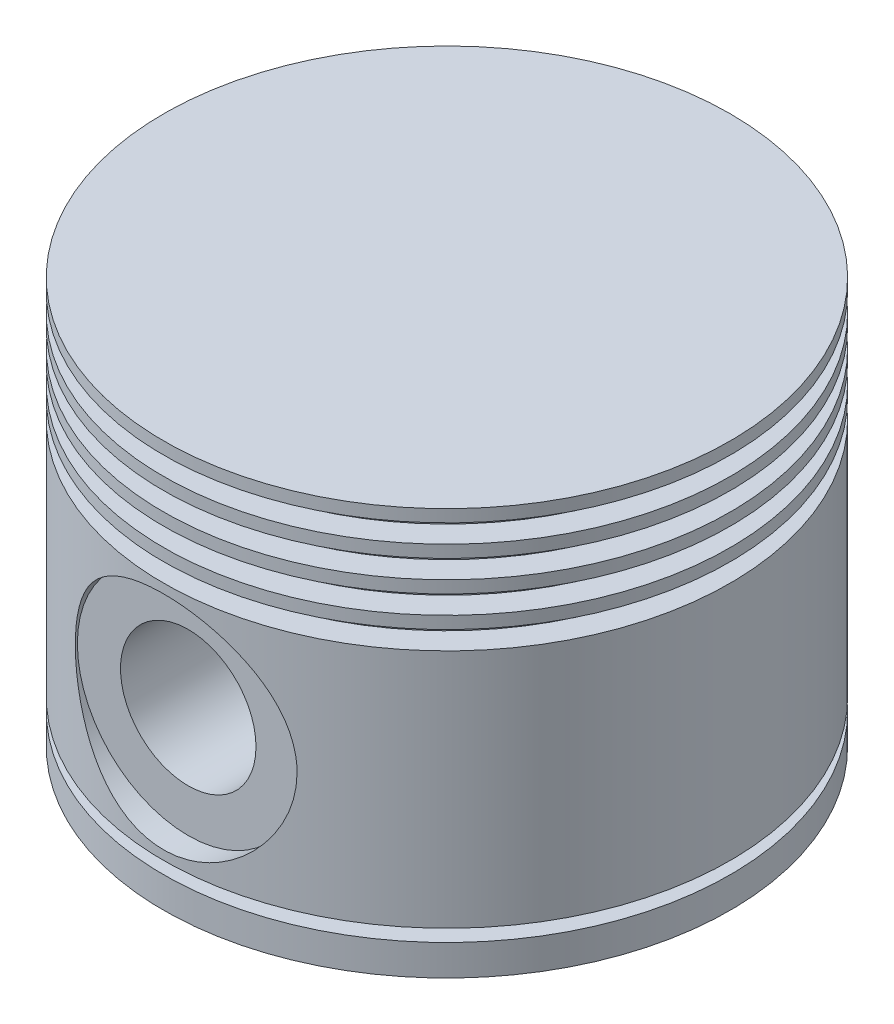
from build123d import *

# Parameters (mm, degrees)
CUT_EXTRUDE1_DEPTH      = 93.671462706
CUT_EXTRUDE1_DEPTH_BACK = 93.671462706
SKETCH2_R               = 11
BOSS_EXTRUDE1_REACH     = 119.671
BOSS_EXTRUDE1_START     = 25
SKETCH2_3_R             = 18
SKETCH2_3_R_2           = 11
CUT_EXTRUDE3_START      = 42
SKETCH2_5_R             = 18
SKETCH2_5_R_2           = 11
CUT_EXTRUDE3_DEPTH      = 4


with BuildPart() as part:
    # Sketch1 → Revolve1 (revolve)
    with BuildSketch(Plane.XY):
        Polygon((0, 66), (46, 66), (46, 64), (42, 64), (42, 61), (46, 61), (46, 59), (42, 59), (42, 56), (46, 56), (46, 54), (42, 54), (42, 51), (46, 51), (46, 49), (42, 49), (42, 46), (46, 46), (46, 7), (42, 7), (42, 5), (46, 5), (46, 0), (37, 0), (37, 62), (0, 62), align=None)
    revolve(axis=Axis((0, 0, 0), (0, 1, 0)))

    # Sketch2 → Cut-Extrude1 (cut, two sides: drawn at the far end of the back side and taken through both)
    with BuildSketch(Plane.XY.offset(-CUT_EXTRUDE1_DEPTH_BACK)):
        with Locations((0, 26.5)):
            Circle(SKETCH2_R)
    extrude(amount=CUT_EXTRUDE1_DEPTH + CUT_EXTRUDE1_DEPTH_BACK, mode=Mode.SUBTRACT)

    # Sketch2<3> → Boss-Extrude1 (add, up to next)
    with BuildSketch(Plane.XY.offset(BOSS_EXTRUDE1_START), mode=Mode.PRIVATE) as boss_extrude1_sk1:
        with Locations((0, 26.5)):
            Circle(SKETCH2_3_R)
        with Locations((0, 26.5)):
            Circle(SKETCH2_3_R_2, mode=Mode.SUBTRACT)
    boss_extrude1_tool1 = extrude(boss_extrude1_sk1.sketch, amount=BOSS_EXTRUDE1_REACH, mode=Mode.PRIVATE) - part.part
    boss_extrude1 = boss_extrude1_tool1.solids().sort_by_distance((-17.490883, 26.5, 25))[0]
    add(boss_extrude1)

    # Sketch2<5> → Cut-Extrude3 (cut)
    with BuildSketch(Plane.XY.offset(CUT_EXTRUDE3_START)):
        with Locations((0, 26.5)):
            Circle(SKETCH2_5_R)
        with Locations((0, 26.5)):
            Circle(SKETCH2_5_R_2, mode=Mode.SUBTRACT)
    cut_extrude3 = extrude(amount=CUT_EXTRUDE3_DEPTH, mode=Mode.SUBTRACT)

    # Mirror1: Boss-Extrude1, Cut-Extrude3 across plane
    add(boss_extrude1.mirror(Plane.XY))
    add(cut_extrude3.mirror(Plane.XY), mode=Mode.SUBTRACT)


solid = part.part
